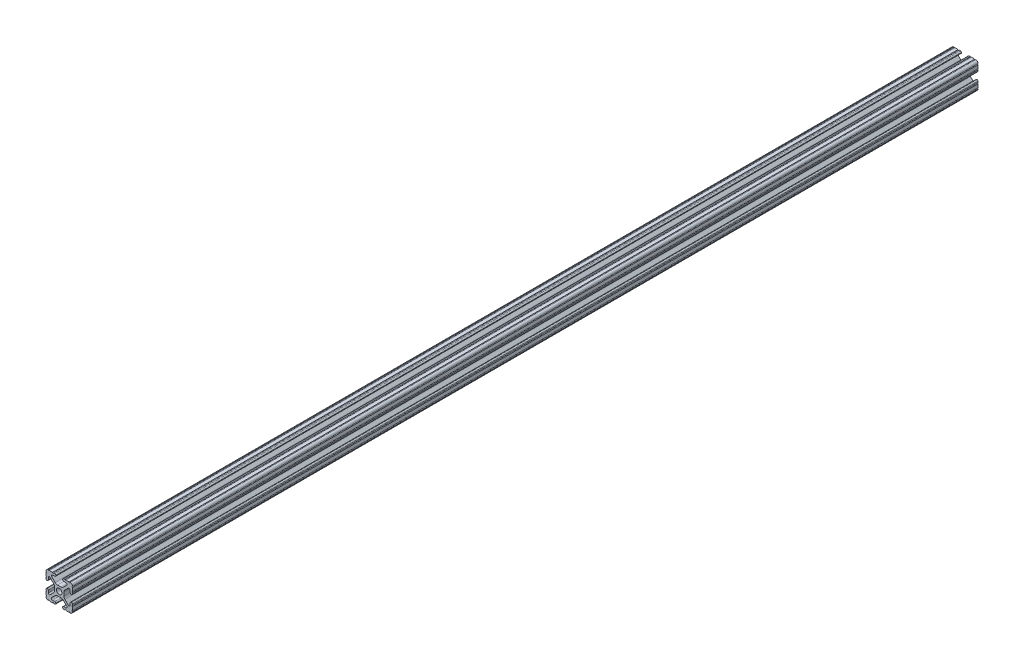
from build123d import *

# Parameters (mm, degrees)
SKETCH1_R          = 2.6035
EXTRUDE1_DEPTH     = 1219.2
SKETCH2_W          = 67.562409857
SKETCH2_H          = 369.908237117
CUT_EXTRUDE2_DEPTH = 1220.530684321


with BuildPart() as part:
    # Sketch1 → Extrude1 (new body)
    with BuildSketch(Plane.XY):
        with BuildLine():
            Line((-7.207036008, 8.724370562), (-3.898272566, 5.423169045))
            ThreePointArc((-3.898272566, 5.423169045), (-2.869120213, 4.736787962), (-1.655778399, 4.4958))
            Line((-1.655778399, 4.4958), (1.655778399, 4.4958))
            ThreePointArc((1.655778399, 4.4958), (2.869120213, 4.736787962), (3.898272566, 5.423169045))
            Line((3.898272566, 5.423169045), (7.207036008, 8.724370562))
            ThreePointArc((7.207036008, 8.724370562), (7.432222385, 9.85140422), (6.476788598, 10.4902))
            Line((6.476788598, 10.4902), (4.287512407, 10.4902))
            ThreePointArc((4.287512407, 10.4902), (3.54574862, 10.79744862), (3.2385, 11.539212407))
            Line((3.2385, 11.539212407), (3.2385, 11.650987593))
            ThreePointArc((3.2385, 11.650987593), (3.54574862, 12.39275138), (4.287512407, 12.7))
            Line((4.287512407, 12.7), (5.317126718, 12.7))
            ThreePointArc((5.317126718, 12.7), (5.825126718, 12.192), (6.333126718, 12.7))
            Line((6.333126718, 12.7), (9.550443118, 12.7))
            ThreePointArc((9.550443118, 12.7), (10.058366869, 12.192000006), (10.566443095, 12.699847501))
            ThreePointArc((10.566443095, 12.699847501), (12.082537762, 12.08250727), (12.699846982, 10.566399977))
            ThreePointArc((12.699846982, 10.566399977), (12.192000006, 10.058323491), (12.7, 9.5504))
            Line((12.7, 9.5504), (12.7, 6.3330836))
            ThreePointArc((12.7, 6.3330836), (12.192, 5.8250836), (12.7, 5.3170836))
            Line((12.7, 5.3170836), (12.7, 4.287469289))
            ThreePointArc((12.7, 4.287469289), (12.39275138, 3.545705502), (11.650987593, 3.238456882))
            Line((11.650987593, 3.238456882), (11.539212407, 3.238456882))
            ThreePointArc((11.539212407, 3.238456882), (10.79744862, 3.545705502), (10.4902, 4.287469289))
            Line((10.4902, 4.287469289), (10.4902, 6.402089023))
            ThreePointArc((10.4902, 6.402089023), (9.856505071, 7.351067942), (8.737131347, 7.129408934))
            Line((8.737131347, 7.129408934), (5.441005833, 3.840816462))
            ThreePointArc((5.441005833, 3.840816462), (4.750877967, 2.809883091), (4.5085, 1.593185507))
            Line((4.5085, 1.593185507), (4.5085, -1.593185507))
            ThreePointArc((4.5085, -1.593185507), (4.750877967, -2.809883091), (5.441005833, -3.840816462))
            Line((5.441005833, -3.840816462), (8.737131347, -7.129408934))
            ThreePointArc((8.737131347, -7.129408934), (9.856505071, -7.351067942), (10.4902, -6.402089023))
            Line((10.4902, -6.402089023), (10.4902, -4.287469289))
            ThreePointArc((10.4902, -4.287469289), (10.79744862, -3.545705502), (11.539212407, -3.238456882))
            Line((11.539212407, -3.238456882), (11.650987593, -3.238456882))
            ThreePointArc((11.650987593, -3.238456882), (12.39275138, -3.545705502), (12.7, -4.287469289))
            Line((12.7, -4.287469289), (12.7, -5.3170836))
            ThreePointArc((12.7, -5.3170836), (12.192, -5.8250836), (12.7, -6.3330836))
            Line((12.7, -6.3330836), (12.7, -9.5504))
            ThreePointArc((12.7, -9.5504), (12.192000006, -10.058323491), (12.699846982, -10.566399977))
            ThreePointArc((12.699846982, -10.566399977), (12.082537762, -12.08250727), (10.566443095, -12.699847501))
            ThreePointArc((10.566443095, -12.699847501), (10.058366869, -12.192000006), (9.550443118, -12.7))
            Line((9.550443118, -12.7), (6.333126718, -12.7))
            ThreePointArc((6.333126718, -12.7), (5.825126718, -12.192), (5.317126718, -12.7))
            Line((5.317126718, -12.7), (4.287512407, -12.7))
            ThreePointArc((4.287512407, -12.7), (3.54574862, -12.39275138), (3.2385, -11.650987593))
            Line((3.2385, -11.650987593), (3.2385, -11.539212407))
            ThreePointArc((3.2385, -11.539212407), (3.54574862, -10.79744862), (4.287512407, -10.4902))
            Line((4.287512407, -10.4902), (6.416408329, -10.4902))
            ThreePointArc((6.416408329, -10.4902), (7.41473083, -9.822813117), (7.179650497, -8.645192506))
            Line((7.179650497, -8.645192506), (3.952270251, -5.423690499))
            ThreePointArc((3.952270251, -5.423690499), (2.922936451, -4.736929036), (1.709253557, -4.4958))
            Line((1.709253557, -4.4958), (-1.709253557, -4.4958))
            ThreePointArc((-1.709253557, -4.4958), (-2.922936451, -4.736929036), (-3.952270251, -5.423690499))
            Line((-3.952270251, -5.423690499), (-7.179650497, -8.645192506))
            ThreePointArc((-7.179650497, -8.645192506), (-7.41473083, -9.822813117), (-6.416408329, -10.4902))
            Line((-6.416408329, -10.4902), (-4.287512407, -10.4902))
            ThreePointArc((-4.287512407, -10.4902), (-3.54574862, -10.79744862), (-3.2385, -11.539212407))
            Line((-3.2385, -11.539212407), (-3.2385, -11.650987593))
            ThreePointArc((-3.2385, -11.650987593), (-3.54574862, -12.39275138), (-4.287512407, -12.7))
            Line((-4.287512407, -12.7), (-5.317126718, -12.7))
            ThreePointArc((-5.317126718, -12.7), (-5.825126718, -12.192), (-6.333126718, -12.7))
            Line((-6.333126718, -12.7), (-9.550443118, -12.7))
            ThreePointArc((-9.550443118, -12.7), (-10.058366869, -12.192000006), (-10.566443095, -12.699847501))
            ThreePointArc((-10.566443095, -12.699847501), (-12.082537762, -12.08250727), (-12.699846982, -10.566399977))
            ThreePointArc((-12.699846982, -10.566399977), (-12.192000006, -10.058323491), (-12.7, -9.5504))
            Line((-12.7, -9.5504), (-12.7, -6.3330836))
            ThreePointArc((-12.7, -6.3330836), (-12.192, -5.8250836), (-12.7, -5.3170836))
            Line((-12.7, -5.3170836), (-12.7, -4.287469289))
            ThreePointArc((-12.7, -4.287469289), (-12.39275138, -3.545705502), (-11.650987593, -3.238456882))
            Line((-11.650987593, -3.238456882), (-11.539212407, -3.238456882))
            ThreePointArc((-11.539212407, -3.238456882), (-10.79744862, -3.545705502), (-10.4902, -4.287469289))
            Line((-10.4902, -4.287469289), (-10.4902, -6.402089023))
            ThreePointArc((-10.4902, -6.402089023), (-9.856505071, -7.351067942), (-8.737131347, -7.129408934))
            Line((-8.737131347, -7.129408934), (-5.441005833, -3.840816462))
            ThreePointArc((-5.441005833, -3.840816462), (-4.750877967, -2.809883091), (-4.5085, -1.593185507))
            Line((-4.5085, -1.593185507), (-4.5085, 1.593185507))
            ThreePointArc((-4.5085, 1.593185507), (-4.750877967, 2.809883091), (-5.441005833, 3.840816462))
            Line((-5.441005833, 3.840816462), (-8.737131347, 7.129408934))
            ThreePointArc((-8.737131347, 7.129408934), (-9.856505071, 7.351067942), (-10.4902, 6.402089023))
            Line((-10.4902, 6.402089023), (-10.4902, 4.287469289))
            ThreePointArc((-10.4902, 4.287469289), (-10.79744862, 3.545705502), (-11.539212407, 3.238456882))
            Line((-11.539212407, 3.238456882), (-11.650987593, 3.238456882))
            ThreePointArc((-11.650987593, 3.238456882), (-12.39275138, 3.545705502), (-12.7, 4.287469289))
            Line((-12.7, 4.287469289), (-12.7, 5.3170836))
            ThreePointArc((-12.7, 5.3170836), (-12.192, 5.8250836), (-12.7, 6.3330836))
            Line((-12.7, 6.3330836), (-12.7, 9.5504))
            ThreePointArc((-12.7, 9.5504), (-12.192000006, 10.058323491), (-12.699846982, 10.566399977))
            ThreePointArc((-12.699846982, 10.566399977), (-12.082537762, 12.08250727), (-10.566443095, 12.699847501))
            ThreePointArc((-10.566443095, 12.699847501), (-10.058366869, 12.192000006), (-9.550443118, 12.7))
            Line((-9.550443118, 12.7), (-6.333126718, 12.7))
            ThreePointArc((-6.333126718, 12.7), (-5.825126718, 12.192), (-5.317126718, 12.7))
            Line((-5.317126718, 12.7), (-4.287512407, 12.7))
            ThreePointArc((-4.287512407, 12.7), (-3.54574862, 12.39275138), (-3.2385, 11.650987593))
            Line((-3.2385, 11.650987593), (-3.2385, 11.539212407))
            ThreePointArc((-3.2385, 11.539212407), (-3.54574862, 10.79744862), (-4.287512407, 10.4902))
            Line((-4.287512407, 10.4902), (-6.476788598, 10.4902))
            ThreePointArc((-6.476788598, 10.4902), (-7.432222385, 9.85140422), (-7.207036008, 8.724370562))
        make_face()
        Circle(SKETCH1_R, mode=Mode.SUBTRACT)
    extrude(amount=-EXTRUDE1_DEPTH)

    # Sketch2 → Cut-Extrude2 (cut, through all)
    with BuildSketch(Plane(origin=(0, 12.7, 0), x_dir=(1, 0, 0), z_dir=(0, 1, 0))):
        with Locations((-12.93218868, 1054.954118558)):
            Rectangle(SKETCH2_W, SKETCH2_H)
    extrude(amount=-CUT_EXTRUDE2_DEPTH, mode=Mode.SUBTRACT)


solid = part.part
